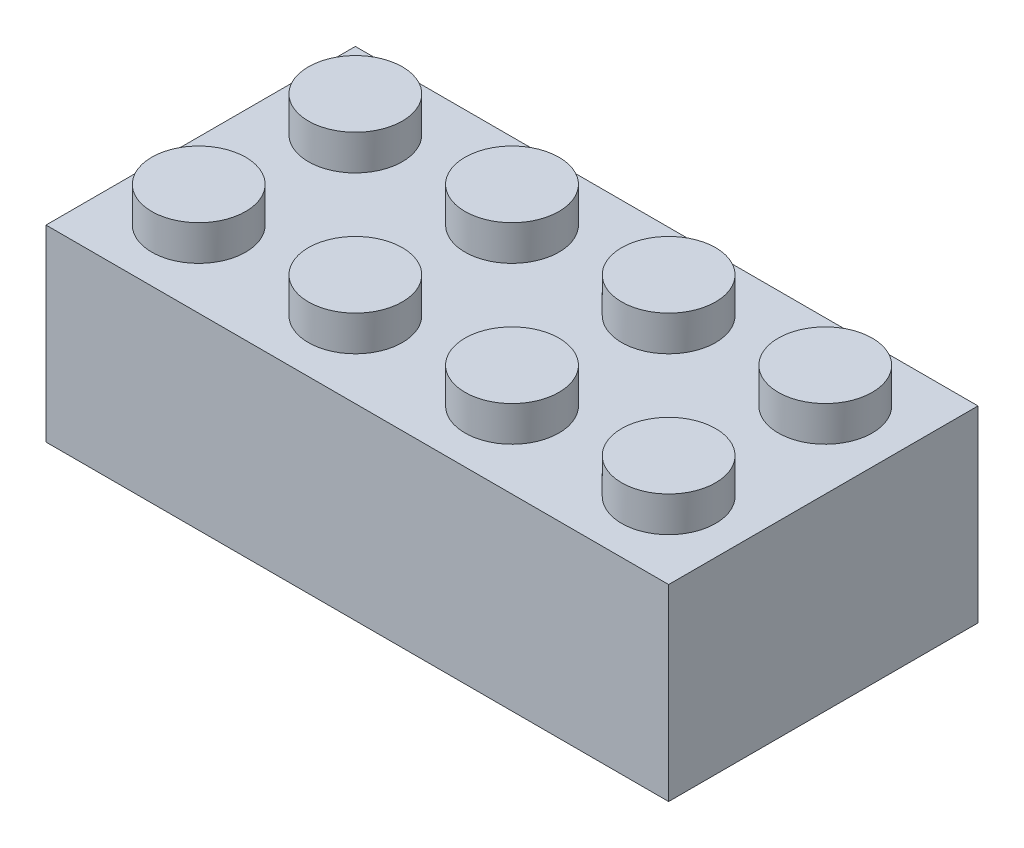
from build123d import *

# Parameters (mm, degrees)
SKETCH1_W           = 31.8
SKETCH1_H           = 15.8
BOSS_EXTRUDE1_DEPTH = 9.6
SHELL1_T            = -1.2
SKETCH2_R           = 2.4
BOSS_EXTRUDE2_DEPTH = 1.8
SKETCH3_R           = 1.4
CUT_EXTRUDE1_DEPTH  = 1.7
BOSS_EXTRUDE3_DEPTH = 6.3
CUT_EXTRUDE2_DEPTH  = 1.21
SKETCH9_W           = 0.255150705
SKETCH9_H           = 1.884615385
BOSS_EXTRUDE5_DEPTH = 1.2


with BuildPart() as part:
    # Sketch1 → Boss-Extrude1 (new body)
    with BuildSketch(Plane(origin=(0, 0, 0), x_dir=(1, 0, 0), z_dir=(0, 1, 0))):
        with Locations((15.9, 7.9)):
            Rectangle(SKETCH1_W, SKETCH1_H)
    extrude(amount=BOSS_EXTRUDE1_DEPTH)

    # Shell1
    shell1_openings = [part.faces().sort_by_distance(p)[0] for p in [
        (15.9, 0, -7.9),
    ]]
    offset(amount=SHELL1_T, openings=shell1_openings, kind=Kind.INTERSECTION)

    # Sketch2 → Boss-Extrude2 (add)
    with BuildSketch(Plane(origin=(0, 9.6, 0), x_dir=(1, 0, 0), z_dir=(0, 1, 0))):
        with Locations((27.9, 11.9)):
            Circle(SKETCH2_R)
        with Locations((19.9, 11.9)):
            Circle(SKETCH2_R)
        with Locations((11.9, 11.9)):
            Circle(SKETCH2_R)
        with Locations((3.9, 11.9)):
            Circle(SKETCH2_R)
        with Locations((19.9, 3.9)):
            Circle(SKETCH2_R)
        with Locations((11.9, 3.9)):
            Circle(SKETCH2_R)
        with Locations((3.9, 3.9)):
            Circle(SKETCH2_R)
        with Locations((27.9, 3.9)):
            Circle(SKETCH2_R)
    extrude(amount=BOSS_EXTRUDE2_DEPTH)

    # Sketch3 → Cut-Extrude1 (cut)
    with BuildSketch(Plane(origin=(0, 8.4, 0), x_dir=(-1, 0, 0), z_dir=(0, -1, 0))):
        with Locations((-3.9, 3.9)):
            Circle(SKETCH3_R)
        with Locations((-11.9, 3.9)):
            Circle(SKETCH3_R)
        with Locations((-19.9, 3.9)):
            Circle(SKETCH3_R)
        with Locations((-27.9, 3.9)):
            Circle(SKETCH3_R)
        with Locations((-11.9, 11.9)):
            Circle(SKETCH3_R)
        with Locations((-19.9, 11.9)):
            Circle(SKETCH3_R)
        with Locations((-27.9, 11.9)):
            Circle(SKETCH3_R)
        with Locations((-3.9, 11.9)):
            Circle(SKETCH3_R)
    extrude(amount=-CUT_EXTRUDE1_DEPTH, mode=Mode.SUBTRACT)

    # Sketch5 → Boss-Extrude3 (add)
    with BuildSketch(Plane.XZ.offset(-8.4)):
        Polygon((15.5, -14.6), (16.3, -14.6), (16.3, -8.18389477), (16.3, -1.2), (15.5, -1.2), align=None)
    extrude(amount=BOSS_EXTRUDE3_DEPTH)

    # Sketch7 → Cut-Extrude2 (cut)
    # profile 1 of 7: a face of its own
    with BuildSketch(Plane(origin=(0, 0, -15.8), x_dir=(-1, 0, 0), z_dir=(0, 0, -1))):
        with BuildLine():
            Line((-24.470512821, 6.112868063), (-23.770092147, 6.112868063))
            add(Edge.make_bspline(
                [(-23.770092147, 6.112868063), (-23.723351019, 6.112712477), (-23.633602875, 6.112413735), (-23.505029604, 6.110747972), (-23.388202507, 6.105973616), (-23.283182668, 6.101865033), (-23.189972013, 6.094373091), (-23.108284722, 6.087212444), (-23.038497025, 6.077838783), (-22.996251173, 6.06913336), (-22.977123397, 6.065191781)],
                knots=[0, 0, 0, 0, 1.410062039, 2.707475311, 3.878576406, 4.937260626, 5.877586885, 6.699081471, 7.410979367, 8, 8, 8, 8], degree=3))
            add(Edge.make_bspline(
                [(-22.977123397, 6.065191781), (-22.951516773, 6.058865016), (-22.900849784, 6.046346452), (-22.827899718, 6.019886851), (-22.758385394, 5.989267227), (-22.69259557, 5.953303506), (-22.630859778, 5.911728727), (-22.572541468, 5.865260604), (-22.517376004, 5.814153398), (-22.467594374, 5.757118557), (-22.420655322, 5.697282047), (-22.381066696, 5.63257829), (-22.346940216, 5.564916763), (-22.319769699, 5.493609345), (-22.297891726, 5.419347573), (-22.282465486, 5.341458776), (-22.273214299, 5.260297801), (-22.272272443, 5.204939893), (-22.271794872, 5.176870467)],
                knots=[0, 0, 0, 0, 1.027469482, 2.033020251, 3.019912614, 3.986113645, 4.951240523, 5.91722682, 6.890402269, 7.87763091, 8.8651537, 9.85103654, 10.82876324, 11.815024772, 12.821070561, 13.842952187, 14.906261191, 16, 16, 16, 16], degree=3))
            add(Edge.make_bspline(
                [(-22.271794872, 5.176870467), (-22.27326387, 5.130235362), (-22.276130266, 5.039238194), (-22.302855369, 4.907177313), (-22.346631889, 4.783987998), (-22.406955178, 4.66982536), (-22.483774654, 4.566914715), (-22.576099445, 4.47652426), (-22.683981056, 4.400884347), (-22.784410372, 4.348431542), (-22.873124572, 4.314838634), (-22.946157885, 4.291202275), (-23.025824862, 4.27294031), (-23.111362197, 4.256580178), (-23.203125852, 4.244228484), (-23.300895892, 4.235181889), (-23.404742043, 4.22952784), (-23.476081113, 4.228685835), (-23.512780449, 4.228252678)],
                knots=[0, 0, 0, 0, 1.260483769, 2.459530307, 3.627416485, 4.787058657, 5.939039949, 7.08810263, 8.267026773, 9.491475466, 10.141966685, 10.831826277, 11.566392101, 12.351337768, 13.187381173, 14.07005841, 15.007169909, 16, 16, 16, 16], degree=3))
            Line((-23.512780449, 4.228252678), (-22.226923077, 2.612868063))
            Line((-22.226923077, 2.612868063), (-22.615344551, 2.612868063))
            Line((-22.615344551, 2.612868063), (-23.901201923, 4.228252678))
            Line((-23.901201923, 4.228252678), (-24.156410256, 4.228252678))
            Line((-24.156410256, 4.228252678), (-24.156410256, 2.612868063))
            Line((-24.156410256, 2.612868063), (-24.470512821, 2.612868063))
            Line((-24.470512821, 2.612868063), (-24.470512821, 6.112868063))
        make_face()
        with BuildLine():
            Line((-24.156410256, 5.753893704), (-24.156410256, 4.587227037))
            Line((-24.156410256, 4.587227037), (-23.515584936, 4.582319185))
            add(Edge.make_bspline(
                [(-23.515584936, 4.582319185), (-23.485664897, 4.582305948), (-23.42767134, 4.582280292), (-23.343770675, 4.586274068), (-23.265650563, 4.590817386), (-23.193609811, 4.597766732), (-23.127616236, 4.606722804), (-23.067702823, 4.617925788), (-23.013771771, 4.63097785), (-22.950873232, 4.651179476), (-22.880636701, 4.683185494), (-22.804305241, 4.729750993), (-22.739302903, 4.788320112), (-22.684385041, 4.855293568), (-22.64025561, 4.928929817), (-22.609143555, 5.008346186), (-22.589401113, 5.091537784), (-22.587072567, 5.148715892), (-22.585897436, 5.177571589)],
                knots=[0, 0, 0, 0, 1.146690395, 2.22261258, 3.21895312, 4.145990853, 4.996080663, 5.770904154, 6.481378293, 7.121626537, 8.300444488, 9.431385265, 10.535395872, 11.636531494, 12.74115979, 13.810798291, 14.895190096, 16, 16, 16, 16], degree=3))
            add(Edge.make_bspline(
                [(-22.585897436, 5.177571589), (-22.587099557, 5.205718162), (-22.589481722, 5.261494401), (-22.608930491, 5.343150311), (-22.641819872, 5.420217262), (-22.68614211, 5.492381747), (-22.740141265, 5.557887482), (-22.803459078, 5.613934635), (-22.874364273, 5.6601841), (-22.940635471, 5.689738481), (-22.999869684, 5.707858334), (-23.051299344, 5.720609498), (-23.109410822, 5.730853967), (-23.17448628, 5.739062027), (-23.246247911, 5.746116972), (-23.325058562, 5.75086875), (-23.410395342, 5.753682614), (-23.469542273, 5.753821703), (-23.500160256, 5.753893704)],
                knots=[0, 0, 0, 0, 1.101028733, 2.181837193, 3.264309656, 4.369019818, 5.486613113, 6.575447106, 7.666700264, 8.788928104, 9.402425223, 10.0903467, 10.862060571, 11.710948788, 12.657782767, 13.684531032, 14.801375019, 16, 16, 16, 16], degree=3))
            Line((-23.500160256, 5.753893704), (-24.156410256, 5.753893704))
        make_face(mode=Mode.SUBTRACT)
    # profile 2 of 7: a face of its own
    with BuildSketch(Plane(origin=(0, 0, -15.8), x_dir=(-1, 0, 0), z_dir=(0, 0, -1))):
        with BuildLine():
            Line((-21.508974359, 6.112868063), (-21.194871795, 6.112868063))
            Line((-21.194871795, 6.112868063), (-21.194871795, 4.015812775))
            add(Edge.make_bspline(
                [(-21.194871795, 4.015812775), (-21.194918539, 3.986132039), (-21.195007244, 3.929807728), (-21.19441473, 3.849639427), (-21.192755361, 3.778366968), (-21.191709202, 3.715715621), (-21.189381868, 3.661972873), (-21.187483821, 3.616847563), (-21.185043265, 3.58055336), (-21.182110147, 3.559372434), (-21.180849359, 3.550267903)],
                knots=[0, 0, 0, 0, 1.528628734, 2.90083645, 4.128790002, 5.200304208, 6.127813768, 6.898992206, 7.526736466, 8, 8, 8, 8], degree=3))
            add(Edge.make_bspline(
                [(-21.180849359, 3.550267903), (-21.1756719, 3.517421139), (-21.165608714, 3.45357841), (-21.139962336, 3.362670128), (-21.104144835, 3.28073867), (-21.061701792, 3.205227379), (-21.005769181, 3.138238019), (-20.938765646, 3.076526366), (-20.857587877, 3.022554562), (-20.767327271, 2.97320375), (-20.670042034, 2.933538667), (-20.570630768, 2.903545303), (-20.470587788, 2.885266403), (-20.403611623, 2.883149864), (-20.370352564, 2.882098832)],
                knots=[0, 0, 0, 0, 1.035780045, 2.013197591, 2.933192213, 3.817615948, 4.702609284, 5.640816605, 6.646850145, 7.73207398, 8.84249596, 9.914020372, 10.964143139, 12, 12, 12, 12], degree=3))
            add(Edge.make_bspline(
                [(-20.370352564, 2.882098832), (-20.341798824, 2.883172683), (-20.284856262, 2.885314181), (-20.200249831, 2.898575612), (-20.117849722, 2.922476178), (-20.037249043, 2.953315936), (-19.961698058, 2.994063527), (-19.891154616, 3.041134367), (-19.828190682, 3.096345243), (-19.770732684, 3.157445587), (-19.720697748, 3.226385387), (-19.677326607, 3.301663525), (-19.641800677, 3.384412872), (-19.624257152, 3.442567294), (-19.615244391, 3.472443384)],
                knots=[0, 0, 0, 0, 0.994687771, 1.983630487, 2.973142513, 3.978332533, 4.983357753, 5.956394766, 6.925816176, 7.893390482, 8.871859704, 9.88551698, 10.913711441, 12, 12, 12, 12], degree=3))
            add(Edge.make_bspline(
                [(-19.615244391, 3.472443384), (-19.612244266, 3.484791958), (-19.605558778, 3.512309558), (-19.599311733, 3.558830849), (-19.592805207, 3.613720213), (-19.588290637, 3.677372025), (-19.583889417, 3.749572998), (-19.581256344, 3.830699255), (-19.580039311, 3.920456216), (-19.579676631, 3.983093378), (-19.579487179, 4.015812775)],
                knots=[0, 0, 0, 0, 0.558680831, 1.244966039, 2.062412453, 2.990489873, 4.051219941, 5.244515665, 6.560634259, 8, 8, 8, 8], degree=3))
            Line((-19.579487179, 4.015812775), (-19.579487179, 6.112868063))
            Line((-19.579487179, 6.112868063), (-19.265384615, 6.112868063))
            Line((-19.265384615, 6.112868063), (-19.265384615, 3.998985852))
            add(Edge.make_bspline(
                [(-19.265384615, 3.998985852), (-19.265638736, 3.960887473), (-19.266134667, 3.88653617), (-19.270435244, 3.777584811), (-19.277292243, 3.674231829), (-19.286980331, 3.576463333), (-19.299817335, 3.484629174), (-19.314092555, 3.397924405), (-19.332272088, 3.316971413), (-19.353505489, 3.241138995), (-19.377779037, 3.168953482), (-19.409220186, 3.100444867), (-19.444644686, 3.033530467), (-19.486659339, 2.969222359), (-19.533870721, 2.907235805), (-19.587322402, 2.84794673), (-19.645246563, 2.790407684), (-19.708606122, 2.736094618), (-19.776356648, 2.686285941), (-19.848296605, 2.64248817), (-19.923873375, 2.605464552), (-20.002890501, 2.574988628), (-20.085381704, 2.552074029), (-20.171349064, 2.534998873), (-20.260988257, 2.525296576), (-20.321952913, 2.523854645), (-20.352824519, 2.523124473)],
                knots=[0, 0, 0, 0, 1.316592851, 2.569410997, 3.76748051, 4.895814652, 5.963796859, 6.97159953, 7.931736103, 8.829262218, 9.692595152, 10.560224239, 11.431080259, 12.30701507, 13.211635791, 14.121146779, 15.063487852, 16.031507147, 17.00238618, 17.966455255, 18.938106653, 19.907068911, 20.888905087, 21.893141452, 22.933117798, 24, 24, 24, 24], degree=3))
            add(Edge.make_bspline(
                [(-20.352824519, 2.523124473), (-20.386493622, 2.523909239), (-20.452552281, 2.525448945), (-20.549890348, 2.534271695), (-20.643204544, 2.55089009), (-20.733480421, 2.572050033), (-20.819488918, 2.601233771), (-20.902382363, 2.635331896), (-20.980741044, 2.677209156), (-21.055836173, 2.723802549), (-21.125660929, 2.776227187), (-21.189758332, 2.833367361), (-21.248234202, 2.894307738), (-21.300102899, 2.959708104), (-21.346223783, 3.029059811), (-21.385953997, 3.102559051), (-21.420067241, 3.180177367), (-21.437673808, 3.234130567), (-21.446574519, 3.261405723)],
                knots=[0, 0, 0, 0, 1.13879206, 2.234305948, 3.301075583, 4.341971843, 5.366689343, 6.369221514, 7.369726634, 8.367512178, 9.355451585, 10.318319045, 11.268648973, 12.207971039, 13.137398894, 14.081662264, 15.030215811, 16, 16, 16, 16], degree=3))
            add(Edge.make_bspline(
                [(-21.446574519, 3.261405723), (-21.451751677, 3.280038298), (-21.462981049, 3.320452767), (-21.475006346, 3.387339255), (-21.485115428, 3.464354173), (-21.494620986, 3.551502791), (-21.500229944, 3.648852658), (-21.505147383, 3.756361574), (-21.509009002, 3.874159535), (-21.508986229, 3.956214051), (-21.508974359, 3.998985852)],
                knots=[0, 0, 0, 0, 0.625038921, 1.35572334, 2.194682327, 3.136881307, 4.189498639, 5.346923369, 6.617055217, 8, 8, 8, 8], degree=3))
            Line((-21.508974359, 3.998985852), (-21.508974359, 6.112868063))
        make_face()
    # profile 3 of 7: a face of its own
    with BuildSketch(Plane(origin=(0, 0, -15.8), x_dir=(-1, 0, 0), z_dir=(0, 0, -1))):
        with BuildLine():
            Line((-18.726923077, 3.288048352), (-18.431049679, 3.465432166))
            add(Edge.make_bspline(
                [(-18.431049679, 3.465432166), (-18.403531442, 3.419367781), (-18.350807562, 3.331110197), (-18.262856202, 3.211852156), (-18.171723291, 3.11049), (-18.076733958, 3.027613392), (-17.97846801, 2.962364505), (-17.876283956, 2.916162274), (-17.770526145, 2.887346298), (-17.698552324, 2.883846212), (-17.662620192, 2.882098832)],
                knots=[0, 0, 0, 0, 1.272034388, 2.437168799, 3.508375237, 4.49857839, 5.41946034, 6.295179144, 7.148887113, 8, 8, 8, 8], degree=3))
            add(Edge.make_bspline(
                [(-17.662620192, 2.882098832), (-17.631933332, 2.882953505), (-17.571096559, 2.884647895), (-17.481534316, 2.900928697), (-17.394552514, 2.925940826), (-17.311943876, 2.961761758), (-17.234848261, 3.005100243), (-17.167241566, 3.057446421), (-17.108795453, 3.116052626), (-17.060986338, 3.181435281), (-17.024306303, 3.25175243), (-16.996114234, 3.323928381), (-16.980469161, 3.399096949), (-16.978112407, 3.449707412), (-16.976923077, 3.475247871)],
                knots=[0, 0, 0, 0, 1.095163259, 2.171163733, 3.241058638, 4.321873601, 5.38011039, 6.391990106, 7.366004449, 8.327778327, 9.272591725, 10.192022065, 11.087607919, 12, 12, 12, 12], degree=3))
            add(Edge.make_bspline(
                [(-16.976923077, 3.475247871), (-16.978397388, 3.50438872), (-16.981394446, 3.56362781), (-17.006725926, 3.651027463), (-17.046575173, 3.737520033), (-17.083337816, 3.791021298), (-17.102423878, 3.81879755)],
                knots=[0, 0, 0, 0, 0.938893495, 1.908633276, 2.914225137, 4, 4, 4, 4], degree=3))
            add(Edge.make_bspline(
                [(-17.102423878, 3.81879755), (-17.118094492, 3.838844374), (-17.150992987, 3.880930172), (-17.207550499, 3.943575408), (-17.273916614, 4.008193827), (-17.347820168, 4.077252884), (-17.431953257, 4.14754068), (-17.523680772, 4.222408958), (-17.625344631, 4.299010535), (-17.696644127, 4.350383101), (-17.733433494, 4.376890499)],
                knots=[0, 0, 0, 0, 0.722233717, 1.516239348, 2.393582979, 3.351407094, 4.387010283, 5.505090956, 6.712668013, 8, 8, 8, 8], degree=3))
            add(Edge.make_bspline(
                [(-17.733433494, 4.376890499), (-17.77025749, 4.403119087), (-17.840662166, 4.453266149), (-17.939120749, 4.527690433), (-18.027165212, 4.595734302), (-18.104404228, 4.658038314), (-18.170803825, 4.714610919), (-18.226887236, 4.764908858), (-18.271225793, 4.810292419), (-18.295881374, 4.839733761), (-18.306951122, 4.852952198)],
                knots=[0, 0, 0, 0, 1.452282411, 2.77665338, 3.964542531, 5.026858415, 5.96415736, 6.766646006, 7.446254459, 8, 8, 8, 8], degree=3))
            add(Edge.make_bspline(
                [(-18.306951122, 4.852952198), (-18.322423667, 4.873553235), (-18.352852504, 4.914067938), (-18.393018509, 4.977392796), (-18.427157672, 5.042216061), (-18.453920004, 5.108711926), (-18.476456223, 5.175946855), (-18.491614154, 5.244798101), (-18.501105551, 5.314956719), (-18.502077537, 5.36217022), (-18.502564103, 5.385804762)],
                knots=[0, 0, 0, 0, 1.068054152, 2.10047183, 3.106115577, 4.101338837, 5.06977816, 6.043150881, 7.020423561, 8, 8, 8, 8], degree=3))
            add(Edge.make_bspline(
                [(-18.502564103, 5.385804762), (-18.501258894, 5.422834536), (-18.498676374, 5.4961026), (-18.476835856, 5.603133431), (-18.442362963, 5.705319848), (-18.394068075, 5.801650181), (-18.331810722, 5.889616162), (-18.259764747, 5.970229649), (-18.173953261, 6.037998232), (-18.079800638, 6.09721029), (-17.976744266, 6.143556215), (-17.868753362, 6.178517195), (-17.75565629, 6.198326453), (-17.679053156, 6.201169218), (-17.640184295, 6.202611653)],
                knots=[0, 0, 0, 0, 1.005424448, 1.989358655, 2.955360095, 3.929531133, 4.905563448, 5.876582895, 6.856512386, 7.866279853, 8.892233794, 9.918561126, 10.94386622, 12, 12, 12, 12], degree=3))
            add(Edge.make_bspline(
                [(-17.640184295, 6.202611653), (-17.598940195, 6.201189101), (-17.516918843, 6.1983601), (-17.396269627, 6.173762569), (-17.280108911, 6.133061897), (-17.186665646, 6.086873239), (-17.113532885, 6.040741823), (-17.057760152, 5.998721999), (-17.001242701, 5.95034689), (-16.943524646, 5.895487644), (-16.885583987, 5.833640893), (-16.826560535, 5.765230204), (-16.766316266, 5.690673648), (-16.727560406, 5.637449148), (-16.707692308, 5.610163736)],
                knots=[0, 0, 0, 0, 1.286793592, 2.559021753, 3.825965368, 5.121522368, 5.803751409, 6.523245864, 7.299691795, 8.125521123, 9.008227632, 9.944561021, 10.946284179, 12, 12, 12, 12], degree=3))
            Line((-16.707692308, 5.610163736), (-16.991646635, 5.394919345))
            add(Edge.make_bspline(
                [(-16.991646635, 5.394919345), (-17.008792567, 5.417008036), (-17.041811624, 5.459545689), (-17.091941111, 5.519117004), (-17.139189759, 5.573533484), (-17.185740159, 5.620798612), (-17.22913379, 5.663500745), (-17.271250832, 5.700060502), (-17.311485184, 5.730836098), (-17.362202094, 5.763679657), (-17.425919813, 5.796236161), (-17.505904349, 5.823785239), (-17.589490624, 5.840340301), (-17.646420255, 5.842529189), (-17.675240385, 5.843637294)],
                knots=[0, 0, 0, 0, 1.181633172, 2.275549214, 3.290209073, 4.226197932, 5.078386478, 5.862611352, 6.581680152, 7.217281963, 8.414376989, 9.595101626, 10.782541182, 12, 12, 12, 12], degree=3))
            add(Edge.make_bspline(
                [(-17.675240385, 5.843637294), (-17.711396907, 5.842425594), (-17.781121354, 5.840088945), (-17.880111591, 5.814568959), (-17.969205516, 5.774387099), (-18.045758081, 5.718072121), (-18.109495058, 5.651351128), (-18.155600516, 5.574572273), (-18.183350681, 5.489789871), (-18.186736961, 5.430648214), (-18.188461538, 5.400528319)],
                knots=[0, 0, 0, 0, 1.14458467, 2.207223713, 3.21896685, 4.227309161, 5.202851033, 6.127160689, 7.046193047, 8, 8, 8, 8], degree=3))
            add(Edge.make_bspline(
                [(-18.188461538, 5.400528319), (-18.188068412, 5.381776841), (-18.187281516, 5.344243221), (-18.176306718, 5.2887918), (-18.162207389, 5.23348046), (-18.139864757, 5.178557877), (-18.109019454, 5.123063518), (-18.068514278, 5.066041781), (-18.017500966, 5.006990072), (-17.978423953, 4.968582698), (-17.957792468, 4.948304762)],
                knots=[0, 0, 0, 0, 0.858281714, 1.717966888, 2.583508476, 3.4729293, 4.427298488, 5.488583878, 6.674047936, 8, 8, 8, 8], degree=3))
            add(Edge.make_bspline(
                [(-17.957792468, 4.948304762), (-17.950131096, 4.941467736), (-17.931929428, 4.925224528), (-17.898653503, 4.898632247), (-17.854710704, 4.865829475), (-17.801248503, 4.825242158), (-17.737281142, 4.778160696), (-17.662801585, 4.725187084), (-17.578640053, 4.664601625), (-17.518918137, 4.622244084), (-17.487339744, 4.59984723)],
                knots=[0, 0, 0, 0, 0.420754252, 0.999615792, 1.744751191, 2.668019286, 3.750313428, 4.999500688, 6.413464383, 8, 8, 8, 8], degree=3))
            add(Edge.make_bspline(
                [(-17.487339744, 4.59984723), (-17.44935383, 4.57220587), (-17.375799374, 4.518682208), (-17.271141794, 4.438266528), (-17.176247986, 4.35961876), (-17.090784782, 4.283241153), (-17.013907874, 4.20971306), (-16.946470153, 4.138149879), (-16.887784473, 4.069064307), (-16.824605254, 3.980491731), (-16.760047435, 3.871710647), (-16.704605927, 3.738432408), (-16.66964758, 3.604636088), (-16.665076065, 3.514709251), (-16.662820513, 3.470340018)],
                knots=[0, 0, 0, 0, 1.163667725, 2.253281268, 3.268753668, 4.215851969, 5.092017293, 5.902905408, 6.650798638, 7.335211899, 8.59617414, 9.77448103, 10.901945474, 12, 12, 12, 12], degree=3))
            add(Edge.make_bspline(
                [(-16.662820513, 3.470340018), (-16.663477651, 3.438961653), (-16.664779166, 3.37681427), (-16.67974008, 3.285559193), (-16.701659745, 3.196928323), (-16.734696979, 3.112017211), (-16.775020137, 3.029272448), (-16.826186385, 2.950864547), (-16.88549407, 2.875058149), (-16.953527835, 2.803874657), (-17.027973737, 2.738528462), (-17.106657432, 2.6803994), (-17.189707705, 2.631931077), (-17.276674021, 2.592380235), (-17.367576358, 2.561446717), (-17.462384142, 2.539033848), (-17.561253653, 2.525278137), (-17.628454135, 2.523850376), (-17.662620192, 2.523124473)],
                knots=[0, 0, 0, 0, 0.983748083, 1.948392443, 2.894712957, 3.844097841, 4.80183111, 5.778335162, 6.776009319, 7.81870978, 8.863265674, 9.881300176, 10.883814829, 11.87499822, 12.874611388, 13.892143829, 14.928324115, 16, 16, 16, 16], degree=3))
            add(Edge.make_bspline(
                [(-17.662620192, 2.523124473), (-17.689055535, 2.523635655), (-17.741593295, 2.52465158), (-17.819302777, 2.533632861), (-17.895442366, 2.546339964), (-17.969056648, 2.566514034), (-18.04109406, 2.590991011), (-18.111241295, 2.621129344), (-18.179532348, 2.657246545), (-18.246349931, 2.69854157), (-18.311524106, 2.746599315), (-18.374443574, 2.802572811), (-18.437172759, 2.864918316), (-18.497860156, 2.935328879), (-18.5577333, 3.012666962), (-18.61561171, 3.097656146), (-18.672693427, 3.189833499), (-18.708508895, 3.254698585), (-18.726923077, 3.288048352)],
                knots=[0, 0, 0, 0, 0.915332311, 1.819136955, 2.706846663, 3.586547465, 4.459518054, 5.340707479, 6.227863349, 7.133153174, 8.059268498, 9.028702269, 10.047606654, 11.120612155, 12.245963614, 13.433783089, 14.680604001, 16, 16, 16, 16], degree=3))
        make_face()
    # profile 4 of 7: a face of its own
    with BuildSketch(Plane(origin=(0, 0, -15.8), x_dir=(-1, 0, 0), z_dir=(0, 0, -1))):
        with BuildLine():
            Line((-16.303846154, 3.288048352), (-16.007972756, 3.465432166))
            add(Edge.make_bspline(
                [(-16.007972756, 3.465432166), (-15.980454519, 3.419367781), (-15.927730639, 3.331110197), (-15.839779279, 3.211852156), (-15.748646368, 3.11049), (-15.653657035, 3.027613392), (-15.555391087, 2.962364505), (-15.453207033, 2.916162274), (-15.347449222, 2.887346298), (-15.275475401, 2.883846212), (-15.239543269, 2.882098832)],
                knots=[0, 0, 0, 0, 1.272034388, 2.437168799, 3.508375237, 4.49857839, 5.41946034, 6.295179144, 7.148887113, 8, 8, 8, 8], degree=3))
            add(Edge.make_bspline(
                [(-15.239543269, 2.882098832), (-15.208856409, 2.882953505), (-15.148019636, 2.884647895), (-15.058457393, 2.900928697), (-14.97147559, 2.925940826), (-14.888866953, 2.961761758), (-14.811771338, 3.005100243), (-14.744164643, 3.057446421), (-14.68571853, 3.116052626), (-14.637909415, 3.181435281), (-14.60122938, 3.25175243), (-14.573037311, 3.323928381), (-14.557392238, 3.399096949), (-14.555035484, 3.449707412), (-14.553846154, 3.475247871)],
                knots=[0, 0, 0, 0, 1.095163259, 2.171163733, 3.241058638, 4.321873601, 5.38011039, 6.391990106, 7.366004449, 8.327778327, 9.272591725, 10.192022065, 11.087607919, 12, 12, 12, 12], degree=3))
            add(Edge.make_bspline(
                [(-14.553846154, 3.475247871), (-14.555320465, 3.50438872), (-14.558317523, 3.56362781), (-14.583649003, 3.651027463), (-14.62349825, 3.737520033), (-14.660260893, 3.791021298), (-14.679346955, 3.81879755)],
                knots=[0, 0, 0, 0, 0.938893495, 1.908633276, 2.914225137, 4, 4, 4, 4], degree=3))
            add(Edge.make_bspline(
                [(-14.679346955, 3.81879755), (-14.695017569, 3.838844374), (-14.727916064, 3.880930172), (-14.784473576, 3.943575408), (-14.85083969, 4.008193827), (-14.924743245, 4.077252884), (-15.008876334, 4.14754068), (-15.100603849, 4.222408958), (-15.202267708, 4.299010535), (-15.273567204, 4.350383101), (-15.310356571, 4.376890499)],
                knots=[0, 0, 0, 0, 0.722233717, 1.516239348, 2.393582979, 3.351407094, 4.387010283, 5.505090956, 6.712668013, 8, 8, 8, 8], degree=3))
            add(Edge.make_bspline(
                [(-15.310356571, 4.376890499), (-15.347180567, 4.403119087), (-15.417585243, 4.453266149), (-15.516043826, 4.527690433), (-15.604088289, 4.595734302), (-15.681327305, 4.658038314), (-15.747726902, 4.714610919), (-15.803810313, 4.764908858), (-15.84814887, 4.810292419), (-15.872804451, 4.839733761), (-15.883874199, 4.852952198)],
                knots=[0, 0, 0, 0, 1.452282411, 2.77665338, 3.964542531, 5.026858415, 5.96415736, 6.766646006, 7.446254459, 8, 8, 8, 8], degree=3))
            add(Edge.make_bspline(
                [(-15.883874199, 4.852952198), (-15.899346744, 4.873553235), (-15.929775581, 4.914067938), (-15.969941586, 4.977392796), (-16.004080749, 5.042216061), (-16.030843081, 5.108711926), (-16.0533793, 5.175946855), (-16.068537231, 5.244798101), (-16.078028628, 5.314956719), (-16.079000614, 5.36217022), (-16.079487179, 5.385804762)],
                knots=[0, 0, 0, 0, 1.068054152, 2.10047183, 3.106115577, 4.101338837, 5.06977816, 6.043150881, 7.020423561, 8, 8, 8, 8], degree=3))
            add(Edge.make_bspline(
                [(-16.079487179, 5.385804762), (-16.07818197, 5.422834536), (-16.07559945, 5.4961026), (-16.053758933, 5.603133431), (-16.01928604, 5.705319848), (-15.970991152, 5.801650181), (-15.908733799, 5.889616162), (-15.836687824, 5.970229649), (-15.750876338, 6.037998232), (-15.656723715, 6.09721029), (-15.553667343, 6.143556215), (-15.445676439, 6.178517195), (-15.332579367, 6.198326453), (-15.255976233, 6.201169218), (-15.217107372, 6.202611653)],
                knots=[0, 0, 0, 0, 1.005424448, 1.989358655, 2.955360095, 3.929531133, 4.905563448, 5.876582895, 6.856512386, 7.866279853, 8.892233794, 9.918561126, 10.94386622, 12, 12, 12, 12], degree=3))
            add(Edge.make_bspline(
                [(-15.217107372, 6.202611653), (-15.175863271, 6.201189101), (-15.09384192, 6.1983601), (-14.973192704, 6.173762569), (-14.857031988, 6.133061897), (-14.763588723, 6.086873239), (-14.690455961, 6.040741823), (-14.634683229, 5.998721999), (-14.578165778, 5.95034689), (-14.520447723, 5.895487644), (-14.462507064, 5.833640893), (-14.403483612, 5.765230204), (-14.343239343, 5.690673648), (-14.304483483, 5.637449148), (-14.284615385, 5.610163736)],
                knots=[0, 0, 0, 0, 1.286793592, 2.559021753, 3.825965368, 5.121522368, 5.803751409, 6.523245864, 7.299691795, 8.125521123, 9.008227632, 9.944561021, 10.946284179, 12, 12, 12, 12], degree=3))
            Line((-14.284615385, 5.610163736), (-14.568569712, 5.394919345))
            add(Edge.make_bspline(
                [(-14.568569712, 5.394919345), (-14.585715644, 5.417008036), (-14.618734701, 5.459545689), (-14.668864188, 5.519117004), (-14.716112836, 5.573533484), (-14.762663236, 5.620798612), (-14.806056867, 5.663500745), (-14.848173909, 5.700060502), (-14.888408261, 5.730836098), (-14.939125171, 5.763679657), (-15.00284289, 5.796236161), (-15.082827426, 5.823785239), (-15.166413701, 5.840340301), (-15.223343332, 5.842529189), (-15.252163462, 5.843637294)],
                knots=[0, 0, 0, 0, 1.181633172, 2.275549214, 3.290209073, 4.226197932, 5.078386478, 5.862611352, 6.581680152, 7.217281963, 8.414376989, 9.595101626, 10.782541182, 12, 12, 12, 12], degree=3))
            add(Edge.make_bspline(
                [(-15.252163462, 5.843637294), (-15.288319984, 5.842425594), (-15.358044431, 5.840088945), (-15.457034667, 5.814568959), (-15.546128593, 5.774387099), (-15.622681158, 5.718072121), (-15.686418135, 5.651351128), (-15.732523593, 5.574572273), (-15.760273758, 5.489789871), (-15.763660038, 5.430648214), (-15.765384615, 5.400528319)],
                knots=[0, 0, 0, 0, 1.14458467, 2.207223713, 3.21896685, 4.227309161, 5.202851033, 6.127160689, 7.046193047, 8, 8, 8, 8], degree=3))
            add(Edge.make_bspline(
                [(-15.765384615, 5.400528319), (-15.764991489, 5.381776841), (-15.764204593, 5.344243221), (-15.753229795, 5.2887918), (-15.739130466, 5.23348046), (-15.716787834, 5.178557877), (-15.685942531, 5.123063518), (-15.645437355, 5.066041781), (-15.594424043, 5.006990072), (-15.55534703, 4.968582698), (-15.534715545, 4.948304762)],
                knots=[0, 0, 0, 0, 0.858281714, 1.717966888, 2.583508476, 3.4729293, 4.427298488, 5.488583878, 6.674047936, 8, 8, 8, 8], degree=3))
            add(Edge.make_bspline(
                [(-15.534715545, 4.948304762), (-15.527054172, 4.941467736), (-15.508852505, 4.925224528), (-15.47557658, 4.898632247), (-15.431633781, 4.865829475), (-15.37817158, 4.825242158), (-15.314204218, 4.778160696), (-15.239724662, 4.725187084), (-15.155563129, 4.664601625), (-15.095841214, 4.622244084), (-15.064262821, 4.59984723)],
                knots=[0, 0, 0, 0, 0.420754252, 0.999615792, 1.744751191, 2.668019286, 3.750313428, 4.999500688, 6.413464383, 8, 8, 8, 8], degree=3))
            add(Edge.make_bspline(
                [(-15.064262821, 4.59984723), (-15.026276907, 4.57220587), (-14.952722451, 4.518682208), (-14.848064871, 4.438266528), (-14.753171063, 4.35961876), (-14.667707859, 4.283241153), (-14.590830951, 4.20971306), (-14.52339323, 4.138149879), (-14.46470755, 4.069064307), (-14.401528331, 3.980491731), (-14.336970512, 3.871710647), (-14.281529004, 3.738432408), (-14.246570657, 3.604636088), (-14.241999141, 3.514709251), (-14.23974359, 3.470340018)],
                knots=[0, 0, 0, 0, 1.163667725, 2.253281268, 3.268753668, 4.215851969, 5.092017293, 5.902905408, 6.650798638, 7.335211899, 8.59617414, 9.77448103, 10.901945474, 12, 12, 12, 12], degree=3))
            add(Edge.make_bspline(
                [(-14.23974359, 3.470340018), (-14.240400728, 3.438961653), (-14.241702243, 3.37681427), (-14.256663157, 3.285559193), (-14.278582822, 3.196928323), (-14.311620056, 3.112017211), (-14.351943214, 3.029272448), (-14.403109462, 2.950864547), (-14.462417147, 2.875058149), (-14.530450912, 2.803874657), (-14.604896814, 2.738528462), (-14.683580509, 2.6803994), (-14.766630782, 2.631931077), (-14.853597098, 2.592380235), (-14.944499435, 2.561446717), (-15.039307219, 2.539033848), (-15.13817673, 2.525278137), (-15.205377212, 2.523850376), (-15.239543269, 2.523124473)],
                knots=[0, 0, 0, 0, 0.983748083, 1.948392443, 2.894712957, 3.844097841, 4.80183111, 5.778335162, 6.776009319, 7.81870978, 8.863265674, 9.881300176, 10.883814829, 11.87499822, 12.874611388, 13.892143829, 14.928324115, 16, 16, 16, 16], degree=3))
            add(Edge.make_bspline(
                [(-15.239543269, 2.523124473), (-15.265978612, 2.523635655), (-15.318516372, 2.52465158), (-15.396225854, 2.533632861), (-15.472365443, 2.546339964), (-15.545979725, 2.566514034), (-15.618017137, 2.590991011), (-15.688164372, 2.621129344), (-15.756455425, 2.657246545), (-15.823273008, 2.69854157), (-15.888447183, 2.746599315), (-15.951366651, 2.802572811), (-16.014095836, 2.864918316), (-16.074783233, 2.935328879), (-16.134656377, 3.012666962), (-16.192534786, 3.097656146), (-16.249616504, 3.189833499), (-16.285431972, 3.254698585), (-16.303846154, 3.288048352)],
                knots=[0, 0, 0, 0, 0.915332311, 1.819136955, 2.706846663, 3.586547465, 4.459518054, 5.340707479, 6.227863349, 7.133153174, 8.059268498, 9.028702269, 10.047606654, 11.120612155, 12.245963614, 13.433783089, 14.680604001, 16, 16, 16, 16], degree=3))
        make_face()
    # profile 5 of 7: a face of its own
    with BuildSketch(Plane(origin=(0, 0, -15.8), x_dir=(-1, 0, 0), z_dir=(0, 0, -1))):
        Polygon((-13.521794872, 6.112868063), (-11.547435897, 6.112868063), (-11.547435897, 5.753893704), (-13.207692308, 5.753893704), (-13.207692308, 4.676970627), (-11.547435897, 4.676970627), (-11.547435897, 4.317996268), (-13.207692308, 4.317996268), (-13.207692308, 2.971842422), (-11.547435897, 2.971842422), (-11.547435897, 2.612868063), (-13.521794872, 2.612868063), align=None)
    # profile 6 of 7: a face of its own
    with BuildSketch(Plane(origin=(0, 0, -15.8), x_dir=(-1, 0, 0), z_dir=(0, 0, -1))):
        Polygon((-10.919230769, 6.112868063), (-10.605128205, 6.112868063), (-10.605128205, 2.971842422), (-9.258974359, 2.971842422), (-9.258974359, 2.612868063), (-10.919230769, 2.612868063), align=None)
    # profile 7 of 7: a face of its own
    with BuildSketch(Plane(origin=(0, 0, -15.8), x_dir=(-1, 0, 0), z_dir=(0, 0, -1))):
        Polygon((-8.675641026, 6.112868063), (-8.361538462, 6.112868063), (-8.361538462, 2.971842422), (-7.015384615, 2.971842422), (-7.015384615, 2.612868063), (-8.675641026, 2.612868063), align=None)
    extrude(amount=-CUT_EXTRUDE2_DEPTH, mode=Mode.SUBTRACT)


with BuildPart() as cut_extrude2_piece_1:
    # of the separate pieces the step leaves, piece 1, a body of its own (cut_extrude2_pieces)
    add(part.part.solids().sort_by_distance((0, 0, 0))[0])



with BuildPart() as cut_extrude2_piece_2:
    # of the separate pieces the step leaves, piece 2, a body of its own (cut_extrude2_pieces)
    add(part.part.solids().sort_by_distance((24.156410256, 5.753893704, -15.8))[0])


with BuildPart() as cut_extrude2_piece_1_1:
    add(cut_extrude2_piece_1.part)

    add(cut_extrude2_piece_2.part)  # Boss-Extrude5 merges Cut-Extrude2 piece 2
    # Sketch9 → Boss-Extrude5 (add)
    with BuildSketch(Plane(origin=(0, 0, -15.8), x_dir=(-1, 0, 0), z_dir=(0, 0, -1))):
        with Locations((-24.028834904, 5.170560371)):
            Rectangle(SKETCH9_W, SKETCH9_H)
    extrude(amount=-BOSS_EXTRUDE5_DEPTH)


solid = cut_extrude2_piece_1_1.part
